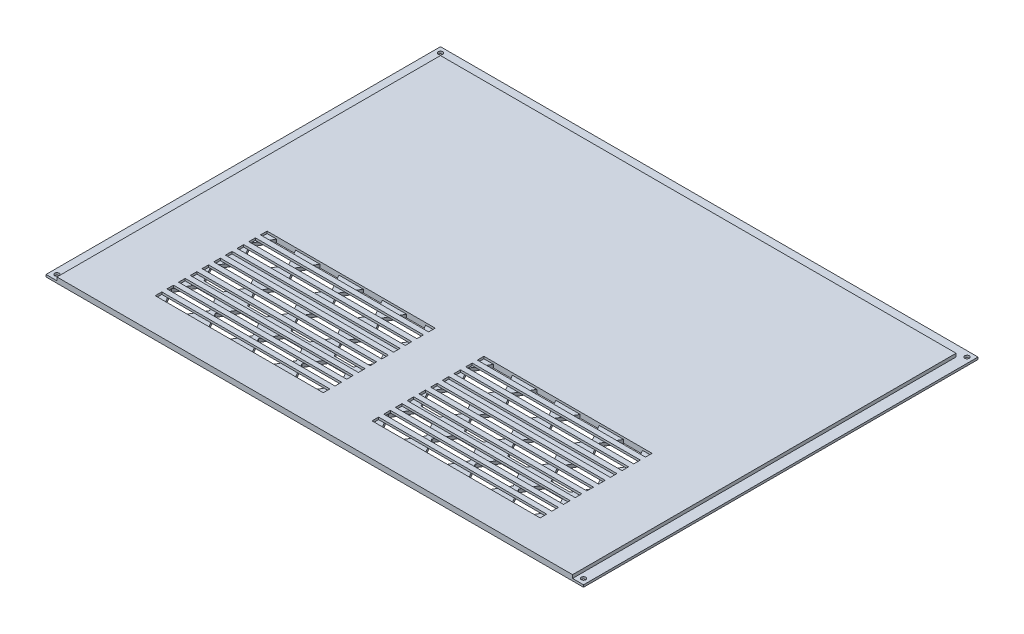
from build123d import *

# Parameters (mm, degrees)
SKETCH1_W                        = 245
SKETCH1_H                        = 179.8
BOSS_EXTRUDE1_DEPTH              = 1
SKETCH2_W                        = 235
SKETCH2_H                        = 174.8
BOSS_EXTRUDE2_DEPTH              = 1.5
CUT_EXTRUDE1_DEPTH               = 1.5
SKETCH6_W                        = 76.624358076
SKETCH6_H                        = 3
CUT_EXTRUDE2_DEPTH               = 1
M2_5X0_45_TAPPED_HOLE1_OUTLINE_R = 1.025
M2_5X0_45_TAPPED_HOLE1_DEPTH     = 1


# Read off the part's stored shape, not the designer's step: M2.5x0.45 Tapped Hole1
with BuildPart() as part:
    # Sketch1 → Boss-Extrude1 (new body)
    with BuildSketch(Plane(origin=(0, 0, 0), x_dir=(1, 0, 0), z_dir=(0, 1, 0))):
        Rectangle(SKETCH1_W, SKETCH1_H)
    extrude(amount=BOSS_EXTRUDE1_DEPTH)

    # Sketch2 → Boss-Extrude2 (add)
    with BuildSketch(Plane(origin=(0, 1, 0), x_dir=(1, 0, 0), z_dir=(0, 1, 0))):
        with Locations((0, -2.5)):
            Rectangle(SKETCH2_W, SKETCH2_H)
    extrude(amount=BOSS_EXTRUDE2_DEPTH)

    # Sketch5 → Cut-Extrude1 (cut)
    with BuildSketch(Plane.XZ):
        Polygon((74.741668943, 59.9), (83.401922981, 59.9), (87.73205, 67.4), (83.401922981, 74.9), (74.741668943, 74.9), (70.411541924, 67.4), align=None)
        Polygon((90.179491924, 67.4), (94.509618943, 59.9), (103.169872981, 59.9), (107.5, 67.4), (103.169872981, 74.9), (94.509618943, 74.9), align=None)
        Polygon((54.973718943, 59.9), (63.633972981, 59.9), (67.9641, 67.4), (63.633972981, 74.9), (54.973718943, 74.9), (50.643591924, 67.4), align=None)
        Polygon((35.205768943, 59.9), (43.866022981, 59.9), (48.19615, 67.4), (43.866022981, 74.9), (35.205768943, 74.9), (30.875641924, 67.4), align=None)
        Polygon((15.437818943, 59.9), (24.098072981, 59.9), (28.4282, 67.4), (24.098072981, 74.9), (15.437818943, 74.9), (11.107691924, 67.4), align=None)
        Polygon((-4.330131057, 59.9), (4.330122981, 59.9), (8.66025, 67.4), (4.330122981, 74.9), (-4.330131057, 74.9), (-8.660258076, 67.4), align=None)
        Polygon((-24.098081057, 59.9), (-15.437827019, 59.9), (-11.1077, 67.4), (-15.437827019, 74.9), (-24.098081057, 74.9), (-28.428208076, 67.4), align=None)
        Polygon((-43.866031057, 59.9), (-35.205777019, 59.9), (-30.87565, 67.4), (-35.205777019, 74.9), (-43.866031057, 74.9), (-48.196158076, 67.4), align=None)
        Polygon((-63.633981057, 59.9), (-54.973727019, 59.9), (-50.6436, 67.4), (-54.973727019, 74.9), (-63.633981057, 74.9), (-67.964108076, 67.4), align=None)
        Polygon((-83.401931057, 59.9), (-74.741677019, 59.9), (-70.41155, 67.4), (-74.741677019, 74.9), (-83.401931057, 74.9), (-87.732058076, 67.4), align=None)
        Polygon((-103.169881057, 59.9), (-94.509627019, 59.9), (-90.1795, 67.4), (-94.509627019, 74.9), (-103.169881057, 74.9), (-107.500008076, 67.4), align=None)
        Polygon((74.741668943, 41.9), (83.401922981, 41.9), (87.73205, 49.4), (83.401922981, 56.9), (74.741668943, 56.9), (70.411541924, 49.4), align=None)
        Polygon((54.973718943, 41.9), (63.633972981, 41.9), (67.9641, 49.4), (63.633972981, 56.9), (54.973718943, 56.9), (50.643591924, 49.4), align=None)
        Polygon((35.205768943, 41.9), (43.866022981, 41.9), (48.19615, 49.4), (43.866022981, 56.9), (35.205768943, 56.9), (30.875641924, 49.4), align=None)
        Polygon((15.437818943, 41.9), (24.098072981, 41.9), (28.4282, 49.4), (24.098072981, 56.9), (15.437818943, 56.9), (11.107691924, 49.4), align=None)
        Polygon((-4.330131057, 41.9), (4.330122981, 41.9), (8.66025, 49.4), (4.330122981, 56.9), (-4.330131057, 56.9), (-8.660258076, 49.4), align=None)
        Polygon((-24.098081057, 41.9), (-15.437827019, 41.9), (-11.1077, 49.4), (-15.437827019, 56.9), (-24.098081057, 56.9), (-28.428208076, 49.4), align=None)
        Polygon((-43.866031057, 41.9), (-35.205777019, 41.9), (-30.87565, 49.4), (-35.205777019, 56.9), (-43.866031057, 56.9), (-48.196158076, 49.4), align=None)
        Polygon((-63.633981057, 41.9), (-54.973727019, 41.9), (-50.6436, 49.4), (-54.973727019, 56.9), (-63.633981057, 56.9), (-67.964108076, 49.4), align=None)
        Polygon((-83.401931057, 41.9), (-74.741677019, 41.9), (-70.41155, 49.4), (-74.741677019, 56.9), (-83.401931057, 56.9), (-87.732058076, 49.4), align=None)
        Polygon((-103.169881057, 41.9), (-94.509627019, 41.9), (-90.1795, 49.4), (-94.509627019, 56.9), (-103.169881057, 56.9), (-107.500008076, 49.4), align=None)
        Polygon((74.741668943, 23.9), (83.401922981, 23.9), (87.73205, 31.4), (83.401922981, 38.9), (74.741668943, 38.9), (70.411541924, 31.4), align=None)
        Polygon((54.973718943, 23.9), (63.633972981, 23.9), (67.9641, 31.4), (63.633972981, 38.9), (54.973718943, 38.9), (50.643591924, 31.4), align=None)
        Polygon((35.205768943, 23.9), (43.866022981, 23.9), (48.19615, 31.4), (43.866022981, 38.9), (35.205768943, 38.9), (30.875641924, 31.4), align=None)
        Polygon((15.437818943, 23.9), (24.098072981, 23.9), (28.4282, 31.4), (24.098072981, 38.9), (15.437818943, 38.9), (11.107691924, 31.4), align=None)
        Polygon((-4.330131057, 23.9), (4.330122981, 23.9), (8.66025, 31.4), (4.330122981, 38.9), (-4.330131057, 38.9), (-8.660258076, 31.4), align=None)
        Polygon((-24.098081057, 23.9), (-15.437827019, 23.9), (-11.1077, 31.4), (-15.437827019, 38.9), (-24.098081057, 38.9), (-28.428208076, 31.4), align=None)
        Polygon((-43.866031057, 23.9), (-35.205777019, 23.9), (-30.87565, 31.4), (-35.205777019, 38.9), (-43.866031057, 38.9), (-48.196158076, 31.4), align=None)
        Polygon((-63.633981057, 23.9), (-54.973727019, 23.9), (-50.6436, 31.4), (-54.973727019, 38.9), (-63.633981057, 38.9), (-67.964108076, 31.4), align=None)
        Polygon((-83.401931057, 23.9), (-74.741677019, 23.9), (-70.41155, 31.4), (-74.741677019, 38.9), (-83.401931057, 38.9), (-87.732058076, 31.4), align=None)
        Polygon((-103.169881057, 23.9), (-94.509627019, 23.9), (-90.1795, 31.4), (-94.509627019, 38.9), (-103.169881057, 38.9), (-107.500008076, 31.4), align=None)
        Polygon((94.509618943, 41.9), (103.169872981, 41.9), (107.5, 49.4), (103.169872981, 56.9), (94.509618943, 56.9), (90.179491924, 49.4), align=None)
        Polygon((94.509618943, 23.9), (103.169872981, 23.9), (107.5, 31.4), (103.169872981, 38.9), (94.509618943, 38.9), (90.179491924, 31.4), align=None)
    extrude(amount=-CUT_EXTRUDE1_DEPTH, mode=Mode.SUBTRACT)

    # Sketch6 → Cut-Extrude2 (cut)
    with BuildSketch(Plane(origin=(0, 2.5, 0), x_dir=(1, 0, 0), z_dir=(0, 1, 0))):
        with Locations((-49.419879038, -68.066666)):
            Rectangle(SKETCH6_W, SKETCH6_H)
        with Locations((-49.419879038, -73.4)):
            Rectangle(SKETCH6_W, SKETCH6_H)
        with Locations((-49.419879038, -62.733332)):
            Rectangle(SKETCH6_W, SKETCH6_H)
        with Locations((-49.419879038, -57.399998)):
            Rectangle(SKETCH6_W, SKETCH6_H)
        with Locations((-49.419879038, -52.066664)):
            Rectangle(SKETCH6_W, SKETCH6_H)
        with Locations((-49.419879038, -46.73333)):
            Rectangle(SKETCH6_W, SKETCH6_H)
        with Locations((-49.419879038, -41.399996)):
            Rectangle(SKETCH6_W, SKETCH6_H)
        with Locations((-49.419879038, -36.066662)):
            Rectangle(SKETCH6_W, SKETCH6_H)
        with Locations((-49.419879038, -30.733328)):
            Rectangle(SKETCH6_W, SKETCH6_H)
        with Locations((-49.419879038, -25.399994)):
            Rectangle(SKETCH6_W, SKETCH6_H)
    cut_extrude2 = extrude(amount=-CUT_EXTRUDE2_DEPTH, mode=Mode.SUBTRACT)

    # Mirror1: Cut-Extrude2 across plane
    add(cut_extrude2.mirror(Plane(origin=(0, 0, 0), x_dir=(0, 0, 1), z_dir=(1, 0, 0))), mode=Mode.SUBTRACT)

    # M2.5x0.45 Tapped Hole1 outline → M2.5x0.45 Tapped Hole1 (cut)
    with BuildSketch(Plane(origin=(0, 0, 0), x_dir=(1, 0, 0), z_dir=(0, 1, 0))):
        with Locations((-120, -87.4)):
            Circle(M2_5X0_45_TAPPED_HOLE1_OUTLINE_R)
        with Locations((-120, 87.4)):
            Circle(M2_5X0_45_TAPPED_HOLE1_OUTLINE_R)
        with Locations((120, -87.4)):
            Circle(M2_5X0_45_TAPPED_HOLE1_OUTLINE_R)
        with Locations((120, 87.4)):
            Circle(M2_5X0_45_TAPPED_HOLE1_OUTLINE_R)
    extrude(amount=M2_5X0_45_TAPPED_HOLE1_DEPTH, mode=Mode.SUBTRACT)


solid = part.part
